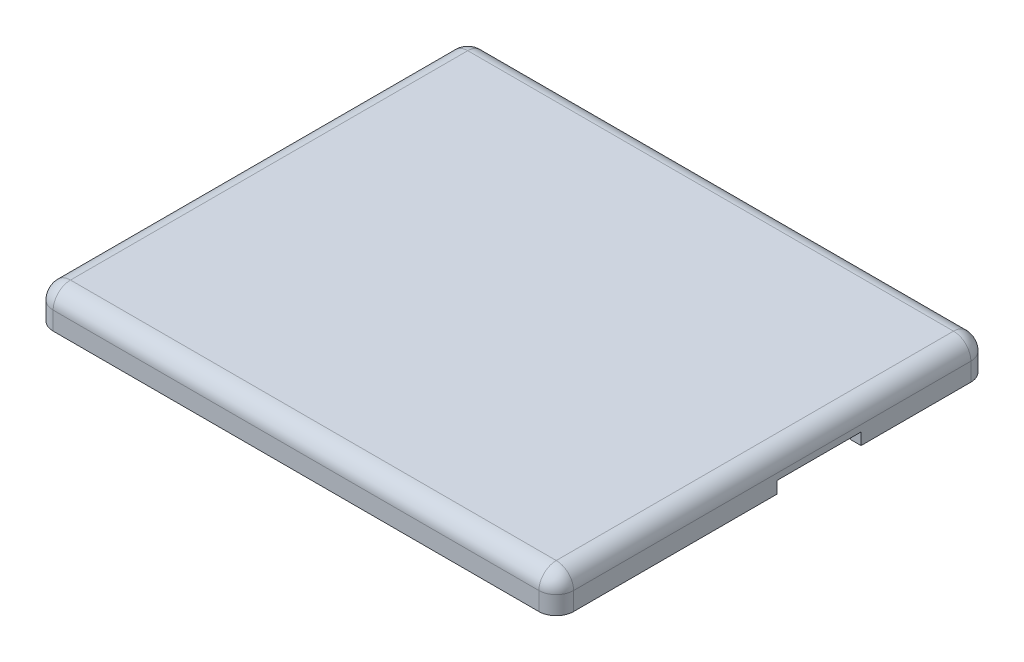
from build123d import *

# Parameters (mm, degrees)
SKETCH1_W          = 60
SKETCH1_H          = 49.8
OUTERWALLS_DEPTH   = 2
SKETCH2_W          = 60
SKETCH2_H          = 49.8
SKETCH2_W_2        = 57.6
SKETCH2_H_2        = 47.4
INNER_DEPTH        = 2.1
SKETCH4_W          = 9.69046632
SKETCH4_H          = 3.323999572
CUT_EXTRUDE1_DEPTH = 20
FILLET1_R          = 2


with BuildPart() as part:
    # Sketch1 → OuterWalls (new body)
    with BuildSketch(Plane(origin=(0, 0, 0), x_dir=(1, 0, 0), z_dir=(0, 1, 0))):
        Rectangle(SKETCH1_W, SKETCH1_H)
    extrude(amount=-OUTERWALLS_DEPTH)

    # Sketch2 → Inner (add)
    with BuildSketch(Plane(origin=(0, -2, 0), x_dir=(-1, 0, 0), z_dir=(0, -1, 0))):
        Rectangle(SKETCH2_W, SKETCH2_H)
        Rectangle(SKETCH2_W_2, SKETCH2_H_2, mode=Mode.SUBTRACT)
    extrude(amount=INNER_DEPTH)

    # Sketch4 → Cut-Extrude1 (cut)
    with BuildSketch(Plane(origin=(30, 0, 0), x_dir=(0, 0, -1), z_dir=(1, 0, 0))):
        with Locations((5.392068789, -4.397644301)):
            Rectangle(SKETCH4_W, SKETCH4_H)
    extrude(amount=-CUT_EXTRUDE1_DEPTH, mode=Mode.SUBTRACT)

    # Fillet1
    fillet1_edges = [part.edges().sort_by_distance(p)[0] for p in [
        (30, 0, 0),
        (-30, -2.05, 24.9),
        (-30, -2.05, -24.9),
        (30, -2.05, -24.9),
        (30, -2.05, 24.9),
        (0, 0, 24.9),
        (-30, 0, 0),
        (0, 0, -24.9),
    ]]
    fillet(fillet1_edges, radius=FILLET1_R)


solid = part.part
